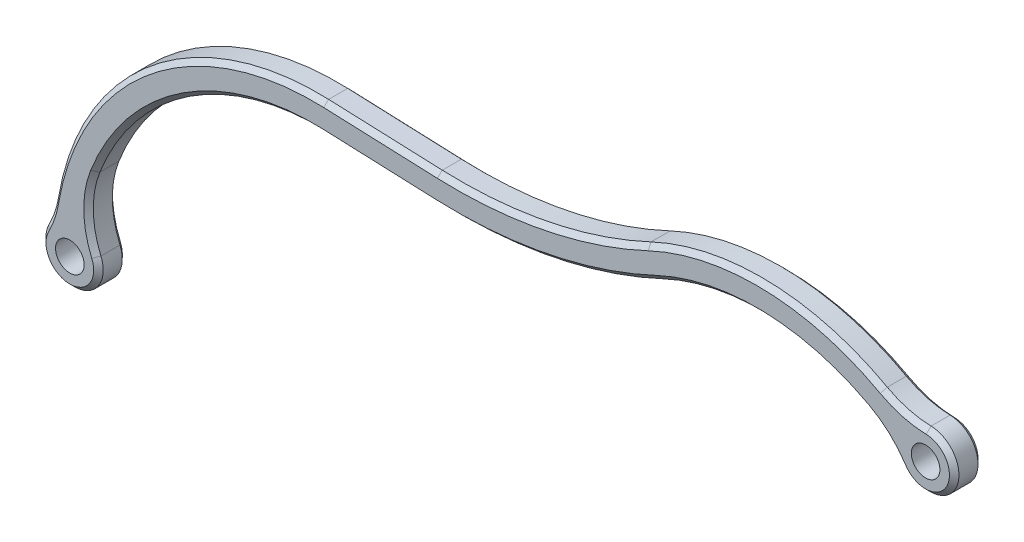
from build123d import *

# Parameters (mm, degrees)
SKETCH1_R           = 1.5
BOSS_EXTRUDE1_DEPTH = 3
FILLET1_R           = 10
CHAMFER1_SIZE       = 0.5


with BuildPart() as part:
    # Sketch1 → Boss-Extrude1 (new body)
    with BuildSketch(Plane.XY):
        with BuildLine():
            ThreePointArc((-80.110964743, 11.011194038), (-99.398655807, 4.184562022), (-108.690787947, -14.04382824))
            ThreePointArc((-108.690787947, -14.04382824), (-106.294231317, -19.302771646), (-105.621986912, -13.562731848))
            ThreePointArc((-105.621986912, -13.562731848), (-97.133116001, 2.177178786), (-80.229187877, 8.013524394))
            Line((-80.229187877, 8.013524394), (-68.3094934, 7.543431352))
            ThreePointArc((-68.3094934, 7.543431352), (-56.383681168, 8.501270624), (-45.024076574, 12.256511885))
            ThreePointArc((-45.024076574, 12.256511885), (-32.132147942, 14.423979547), (-19.981968964, 9.599781095))
            ThreePointArc((-19.981968964, 9.599781095), (-14.269337445, 8.685833715), (-18.71157232, 12.392045797))
            ThreePointArc((-18.71157232, 12.392045797), (-32.153587478, 17.440965919), (-46.2987226, 14.9722581))
            ThreePointArc((-46.2987226, 14.9722581), (-56.978827101, 11.441644974), (-68.191270266, 10.541100995))
            Line((-68.191270266, 10.541100995), (-80.110964743, 11.011194038))
        make_face()
        with Locations((-106.758866773, -16.338971063)):
            Circle(SKETCH1_R, mode=Mode.SUBTRACT)
        with Locations((-17, 9.92820323)):
            Circle(SKETCH1_R, mode=Mode.SUBTRACT)
    extrude(amount=BOSS_EXTRUDE1_DEPTH)

    # Fillet1
    fillet1_edges = [part.edges().sort_by_distance(p)[0] for p in [
        (-18.71157232, 12.392045797, 1.5),
        (-19.981968964, 9.599781095, 1.5),
        (-108.690787947, -14.04382824, 1.5),
        (-105.621986912, -13.562731848, 1.5),
    ]]
    fillet(fillet1_edges, radius=FILLET1_R)

    # Chamfer1
    chamfer1_edges = [part.edges().sort_by_distance(p)[0] for p in [
        (-34.012257166, 14.549992875, 0),
        (-56.383681168, 8.501270624, 0),
        (-21.121056211, 10.194380242, 0),
        (-74.269340639, 7.778477873, 0),
        (-14.380575185, 8.465803273, 0),
        (-94.661424024, 4.023585569, 0),
        (-19.295438526, 13.270786971, 0),
        (-104.798109157, -11.388944784, 0),
        (-33.80961734, 17.545219547, 0),
        (-106.876120802, -19.336678769, 0),
        (-56.978827101, 11.441644974, 0),
        (-108.804227348, -13.508087459, 0),
        (-74.151117504, 10.776147516, 0),
        (-98.605895226, 4.853631931, 0),
        (-34.012257166, 14.549992875, 3),
        (-56.383681168, 8.501270624, 3),
        (-21.121056211, 10.194380242, 3),
        (-74.269340639, 7.778477873, 3),
        (-14.380575185, 8.465803273, 3),
        (-94.661424024, 4.023585569, 3),
        (-19.295438526, 13.270786971, 3),
        (-104.798109157, -11.388944784, 3),
        (-33.80961734, 17.545219547, 3),
        (-106.876120802, -19.336678769, 3),
        (-56.978827101, 11.441644974, 3),
        (-108.804227348, -13.508087459, 3),
        (-74.151117504, 10.776147516, 3),
        (-98.605895226, 4.853631931, 3),
    ]]
    chamfer(chamfer1_edges, length=CHAMFER1_SIZE)


solid = part.part
